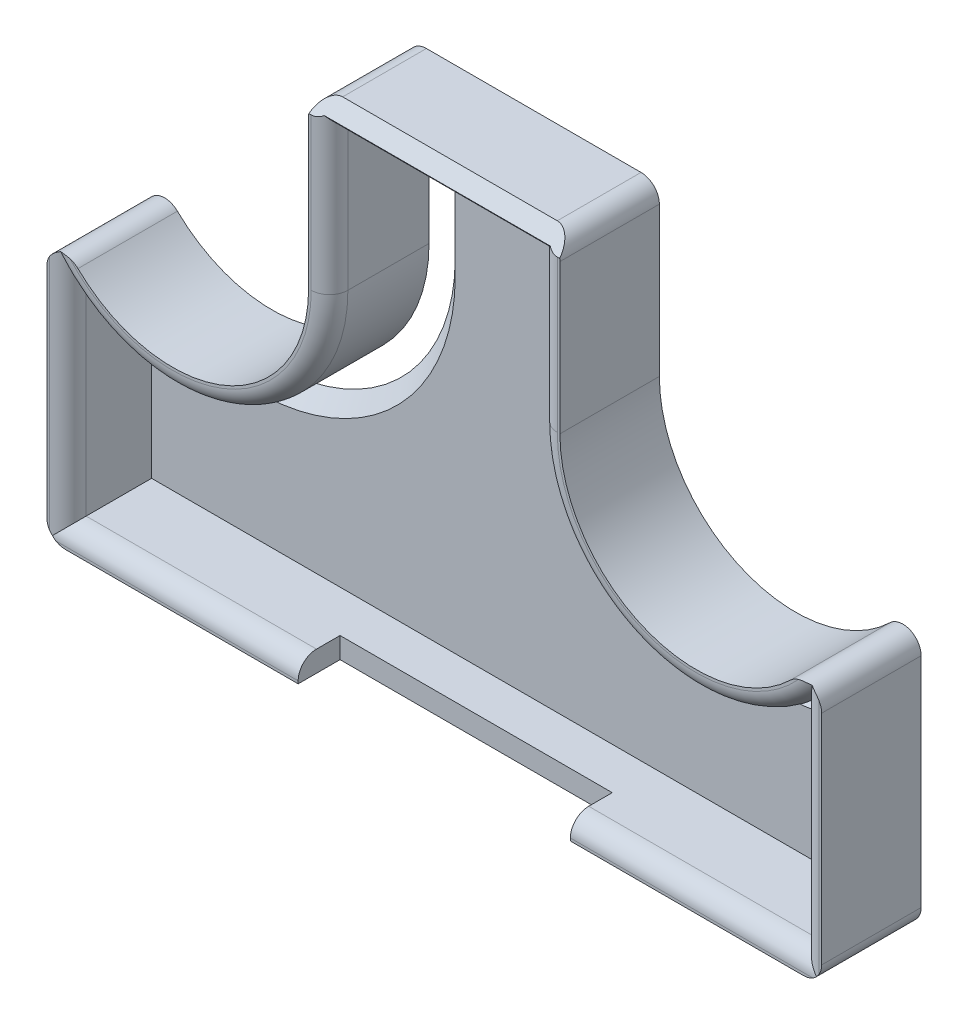
from build123d import *

# Parameters (mm, degrees)
BOSS_EXTRUDE1_DEPTH = 8
BOSS_EXTRUDE2_START = 1.5
BOSS_EXTRUDE2_DEPTH = 1.5
CHAMFER1_SIZE       = 1.5
CHAMFER2_SIZE       = 1.5
FILLET1_R           = 1.75
CUT_EXTRUDE1_REACH  = 89.56
SKETCH3_W           = 26
SKETCH3_H           = 4


# Some blends are built 0.0001 mm under size
with BuildPart() as part:
    # Sketch1 → Boss-Extrude1 (new body)
    with BuildSketch(Plane(origin=(0, 0, 0), x_dir=(-1, 0, 0), z_dir=(0, 0, 1))):
        with BuildLine():
            Line((2, 2), (-72, 2))
            Line((-72, 2), (-72, -26.180339887))
            ThreePointArc((-72, -26.180339887), (-57.450490243, -18.432791104), (-47, -31.180339887))
            Line((-47, -31.180339887), (-47, -47.180339887))
            Line((-47, -47.180339887), (-23, -47.180339887))
            Line((-23, -47.180339887), (-23, -31.180339887))
            ThreePointArc((-23, -31.180339887), (-12.549509757, -18.432791104), (2, -26.180339887))
            Line((2, -26.180339887), (2, 2))
        make_face()
        with BuildLine():
            Line((-70, 0), (0, 0))
            Line((0, 0), (0, -20))
            ThreePointArc((0, -20), (-16.123724357, -17.48727595), (-25, -31.180339887))
            Line((-25, -31.180339887), (-25, -45.180339887))
            Line((-25, -45.180339887), (-45, -45.180339887))
            Line((-45, -45.180339887), (-45, -31.180339887))
            ThreePointArc((-45, -31.180339887), (-53.876275643, -17.48727595), (-70, -20))
            Line((-70, -20), (-70, 0))
        make_face(mode=Mode.SUBTRACT)
    extrude(amount=BOSS_EXTRUDE1_DEPTH)

    # Sketch2 → Boss-Extrude2 (add)
    with BuildSketch(Plane(origin=(0, 0, 0), x_dir=(-1, 0, 0), z_dir=(0, 0, -1)).offset(BOSS_EXTRUDE2_START)):
        with BuildLine():
            Line((2, -2), (-72, -2))
            Line((-72, -2), (-72, 26.180339887))
            ThreePointArc((-72, 26.180339887), (-57.450490243, 18.432791104), (-47, 31.180339887))
            Line((-47, 31.180339887), (-47, 47.180339887))
            Line((-47, 47.180339887), (-23, 47.180339887))
            Line((-23, 47.180339887), (-23, 31.180339887))
            ThreePointArc((-23, 31.180339887), (-12.549509757, 18.432791104), (2, 26.180339887))
            Line((2, 26.180339887), (2, -2))
        make_face()
        with BuildLine():
            Line((-3, 17.913840726), (-3, 15.141324955))
            ThreePointArc((-3, 15.141324955), (-19.585144756, 16.538789423), (-27.5, 31.180339887))
            Line((-27.5, 31.180339887), (-27.5, 43.180339887))
            Line((-27.5, 43.180339887), (-25, 43.180339887))
            Line((-25, 43.180339887), (-25, 31.180339887))
            ThreePointArc((-25, 31.180339887), (-17.745966692, 18.335107309), (-3, 17.913840726))
        make_face(mode=Mode.SUBTRACT)
        with BuildLine():
            Line((-67, 17.913840726), (-67, 15.141324955))
            ThreePointArc((-67, 15.141324955), (-50.414855244, 16.538789423), (-42.5, 31.180339887))
            Line((-42.5, 31.180339887), (-42.5, 43.180339887))
            Line((-42.5, 43.180339887), (-45, 43.180339887))
            Line((-45, 43.180339887), (-45, 31.180339887))
            ThreePointArc((-45, 31.180339887), (-52.254033308, 18.335107309), (-67, 17.913840726))
        make_face(mode=Mode.SUBTRACT)
    extrude(amount=-BOSS_EXTRUDE2_DEPTH)

    # Chamfer1
    chamfer1_edges = [part.edges().sort_by_distance(p)[0] for p in [
        (42.5, 37.180339887, 0),
        (50.414855244, 16.538789423, 0),
        (27.5, 37.180339887, 0),
        (19.585144756, 16.538789423, 0),
    ]]
    chamfer(chamfer1_edges, length=CHAMFER1_SIZE - 0.0001)  # a hair under: the kernel refuses the full size

    # Chamfer2
    chamfer2_edges = [part.edges().sort_by_distance(p)[0] for p in [
        (35, 47.180339887, 8),
    ]]
    chamfer(chamfer2_edges, length=CHAMFER2_SIZE)

    # Fillet1
    # the kernel refuses this fillet: 1.75 mm, written as the material it takes off along each edge
    with BuildSketch(Plane(origin=(10, 31.180339887, 8), x_dir=(-0.8529681786661586, -0.5219629164825181, 0), z_dir=(-0.5219629164825181, 0.8529681786661586, 0))) as fillet1_piece_1_section:
        with BuildLine():
            CenterArc((15 - FILLET1_R, -FILLET1_R), FILLET1_R, 0, 90)
            Line((15, -FILLET1_R), (15 + FILLET1_R * 0.02, -FILLET1_R))
            Line((15 + FILLET1_R * 0.02, -FILLET1_R), (15 + FILLET1_R * 0.02, FILLET1_R * 0.02))
            Line((15 + FILLET1_R * 0.02, FILLET1_R * 0.02), (15 - FILLET1_R, FILLET1_R * 0.02))
            Line((15 - FILLET1_R, FILLET1_R * 0.02), (15 - FILLET1_R, 0))
        make_face()
    fillet1_piece_1 = revolve(axis=Axis((10, 31.180339887, 8), (0, 0, 1)), revolution_arc=148.535987608, mode=Mode.PRIVATE)
    fillet1_piece_1 = split(fillet1_piece_1, bisect_by=Plane(origin=(0, 17.590580618, 7.50852365), z_dir=(1, 0, 0)), keep=Keep.TOP, mode=Mode.PRIVATE)
    add(fillet1_piece_1, mode=Mode.SUBTRACT)
    with BuildSketch(Plane(origin=(0, 0, 8), x_dir=(-1, 0, 0), z_dir=(0, 1, 0))) as fillet1_piece_2_section:
        with BuildLine():
            CenterArc((FILLET1_R, -FILLET1_R), FILLET1_R, 90, 90)
            Line((0, -FILLET1_R), (-FILLET1_R * 0.02, -FILLET1_R))
            Line((-FILLET1_R * 0.02, -FILLET1_R), (-FILLET1_R * 0.02, FILLET1_R * 0.02))
            Line((-FILLET1_R * 0.02, FILLET1_R * 0.02), (FILLET1_R, FILLET1_R * 0.02))
            Line((FILLET1_R, FILLET1_R * 0.02), (FILLET1_R, 0))
        make_face()
    fillet1_piece_2 = extrude(amount=24.375, mode=Mode.PRIVATE)
    fillet1_piece_2 = fillet1_piece_2 - Plane(origin=(10, 31.180339887, 7.607877329), x_dir=(-0.6666666666666653, -0.7453559924999311, 0), z_dir=(0, 0, -1)) * Cylinder(15, 56, mode=Mode.PRIVATE)
    add(fillet1_piece_2, mode=Mode.SUBTRACT)
    with BuildSketch(Plane(origin=(25, 31.180339887, 8), x_dir=(-1, 0, 0), z_dir=(0, 1, 0)), Plane(origin=(45, 45.180339887, 8), x_dir=(1, 0, 0), z_dir=(0, -1, 0))) as fillet1_piece_3:
        with BuildLine():
            CenterArc((FILLET1_R, -FILLET1_R), FILLET1_R, 90, 90)
            Line((0, -FILLET1_R), (-FILLET1_R * 0.02, -FILLET1_R))
            Line((-FILLET1_R * 0.02, -FILLET1_R), (-FILLET1_R * 0.02, FILLET1_R * 0.02))
            Line((-FILLET1_R * 0.02, FILLET1_R * 0.02), (FILLET1_R, FILLET1_R * 0.02))
            Line((FILLET1_R, FILLET1_R * 0.02), (FILLET1_R, 0))
        make_face()
    extrude(amount=14, mode=Mode.SUBTRACT)
    with BuildSketch(Plane(origin=(70, 0, 8), x_dir=(0, -1, 0), z_dir=(-1, 0, 0))) as fillet1_piece_4:
        with BuildLine():
            CenterArc((FILLET1_R, -FILLET1_R), FILLET1_R, 90, 90)
            Line((0, -FILLET1_R), (-FILLET1_R * 0.02, -FILLET1_R))
            Line((-FILLET1_R * 0.02, -FILLET1_R), (-FILLET1_R * 0.02, FILLET1_R * 0.02))
            Line((-FILLET1_R * 0.02, FILLET1_R * 0.02), (FILLET1_R, FILLET1_R * 0.02))
            Line((FILLET1_R, FILLET1_R * 0.02), (FILLET1_R, 0))
        make_face()
    extrude(amount=70, mode=Mode.SUBTRACT)
    with BuildSketch(Plane(origin=(70, 24.375, 8), x_dir=(1, 0, 0), z_dir=(0, -1, 0))) as fillet1_piece_5_section:
        with BuildLine():
            CenterArc((FILLET1_R, -FILLET1_R), FILLET1_R, 90, 90)
            Line((0, -FILLET1_R), (-FILLET1_R * 0.02, -FILLET1_R))
            Line((-FILLET1_R * 0.02, -FILLET1_R), (-FILLET1_R * 0.02, FILLET1_R * 0.02))
            Line((-FILLET1_R * 0.02, FILLET1_R * 0.02), (FILLET1_R, FILLET1_R * 0.02))
            Line((FILLET1_R, FILLET1_R * 0.02), (FILLET1_R, 0))
        make_face()
    fillet1_piece_5 = extrude(amount=24.375, mode=Mode.PRIVATE)
    fillet1_piece_5 = fillet1_piece_5 - Plane(origin=(60, 31.180339887, 7.607877375), x_dir=(-1, 0, 0), z_dir=(0, 0, -1)) * Cylinder(15, 56, mode=Mode.PRIVATE)
    add(fillet1_piece_5, mode=Mode.SUBTRACT)
    with BuildSketch(Plane(origin=(60, 31.180339887, 8), x_dir=(-1, 0, 0), z_dir=(0, 1, 0))) as fillet1_piece_6_section:
        with BuildLine():
            CenterArc((15 - FILLET1_R, -FILLET1_R), FILLET1_R, 0, 90)
            Line((15, -FILLET1_R), (15 + FILLET1_R * 0.02, -FILLET1_R))
            Line((15 + FILLET1_R * 0.02, -FILLET1_R), (15 + FILLET1_R * 0.02, FILLET1_R * 0.02))
            Line((15 + FILLET1_R * 0.02, FILLET1_R * 0.02), (15 - FILLET1_R, FILLET1_R * 0.02))
            Line((15 - FILLET1_R, FILLET1_R * 0.02), (15 - FILLET1_R, 0))
        make_face()
    fillet1_piece_6 = revolve(axis=Axis((60, 31.180339887, 8), (0, 0, 1)), revolution_arc=148.535987608, mode=Mode.PRIVATE)
    fillet1_piece_6 = split(fillet1_piece_6, bisect_by=Plane(origin=(70, 17.590580683, 7.508523582), z_dir=(-1, 0, 0)), keep=Keep.TOP, mode=Mode.PRIVATE)
    add(fillet1_piece_6, mode=Mode.SUBTRACT)
    with BuildSketch(Plane(origin=(25, 45.180339887, 8), x_dir=(0, 1, 0), z_dir=(1, 0, 0))) as fillet1_piece_7:
        with BuildLine():
            CenterArc((FILLET1_R, -FILLET1_R), FILLET1_R, 90, 90)
            Line((0, -FILLET1_R), (-FILLET1_R * 0.02, -FILLET1_R))
            Line((-FILLET1_R * 0.02, -FILLET1_R), (-FILLET1_R * 0.02, FILLET1_R * 0.02))
            Line((-FILLET1_R * 0.02, FILLET1_R * 0.02), (FILLET1_R, FILLET1_R * 0.02))
            Line((FILLET1_R, FILLET1_R * 0.02), (FILLET1_R, 0))
        make_face()
    extrude(amount=20, mode=Mode.SUBTRACT)
    with BuildSketch(Plane(origin=(72, 26.180339887, -1.5), x_dir=(-0.5635217270596511, -0.8261012426644256, 0), z_dir=(0, 0, 1)), Plane(origin=(-2, 26.180339887, 8), x_dir=(0.5635217270596506, -0.8261012426644259, 0), z_dir=(0, 0, -1))) as fillet1_piece_8:
        with BuildLine():
            CenterArc((5.617783669, 1.713764708), FILLET1_R, 124.299700248, 134.020464453)
            Line((4.631620646, 3.159441883), (4.611897386, 3.188355426))
            Line((4.611897386, 3.188355426), (-0.01972326, 0.028913543))
            Line((-0.01972326, 0.028913543), (0.007085493, -0.034275294))
            ThreePointArc((0.007085493, -0.034275294), (2.631754511, 0.234176453), (5.25642353, -0.034275294))
            Line((5.25642353, -0.034275294), (5.263509023, 0))
        make_face()
    extrude(amount=9.5, mode=Mode.SUBTRACT)
    with BuildSketch(Plane(origin=(72, -2, -1.5), x_dir=(0, 1, 0), z_dir=(0, 0, 1)), Plane(origin=(-2, -2, -1.5), x_dir=(1, 0, 0), z_dir=(0, 0, 1))) as fillet1_piece_9:
        with BuildLine():
            CenterArc((FILLET1_R, FILLET1_R), FILLET1_R, 180, 90)
            Line((0, FILLET1_R), (-FILLET1_R * 0.02, FILLET1_R))
            Line((-FILLET1_R * 0.02, FILLET1_R), (-FILLET1_R * 0.02, -FILLET1_R * 0.02))
            Line((-FILLET1_R * 0.02, -FILLET1_R * 0.02), (FILLET1_R, -FILLET1_R * 0.02))
            Line((FILLET1_R, -FILLET1_R * 0.02), (FILLET1_R, 0))
        make_face()
    extrude(amount=9.5, mode=Mode.SUBTRACT)
    with BuildSketch(Plane(origin=(47, 47.180339887, -1.5), x_dir=(0, -1, 0), z_dir=(0, 0, 1))) as fillet1_piece_10_section:
        with BuildLine():
            CenterArc((FILLET1_R, -FILLET1_R), FILLET1_R, 90, 90)
            Line((0, -FILLET1_R), (-FILLET1_R * 0.02, -FILLET1_R))
            Line((-FILLET1_R * 0.02, -FILLET1_R), (-FILLET1_R * 0.02, FILLET1_R * 0.02))
            Line((-FILLET1_R * 0.02, FILLET1_R * 0.02), (FILLET1_R, FILLET1_R * 0.02))
            Line((FILLET1_R, FILLET1_R * 0.02), (FILLET1_R, 0))
        make_face()
    fillet1_piece_10 = extrude(amount=12.375, mode=Mode.PRIVATE)
    fillet1_piece_10 = split(fillet1_piece_10, bisect_by=Plane(origin=(46.61382335, 48.870482081, 4.809857807), z_dir=(0, -0.7071067811865476, -0.7071067811865476)), keep=Keep.TOP, mode=Mode.PRIVATE)
    add(fillet1_piece_10, mode=Mode.SUBTRACT)
    with BuildSketch(Plane(origin=(23, 47.180339887, 10.875), x_dir=(0, -1, 0), z_dir=(0, 0, -1))) as fillet1_piece_11_section:
        with BuildLine():
            CenterArc((FILLET1_R, -FILLET1_R), FILLET1_R, 90, 90)
            Line((0, -FILLET1_R), (-FILLET1_R * 0.02, -FILLET1_R))
            Line((-FILLET1_R * 0.02, -FILLET1_R), (-FILLET1_R * 0.02, FILLET1_R * 0.02))
            Line((-FILLET1_R * 0.02, FILLET1_R * 0.02), (FILLET1_R, FILLET1_R * 0.02))
            Line((FILLET1_R, FILLET1_R * 0.02), (FILLET1_R, 0))
        make_face()
    fillet1_piece_11 = extrude(amount=12.375, mode=Mode.PRIVATE)
    fillet1_piece_11 = split(fillet1_piece_11, bisect_by=Plane(origin=(23.38617665, 48.870482081, 4.809857807), z_dir=(0, -0.7071067811865476, -0.7071067811865476)), keep=Keep.TOP, mode=Mode.PRIVATE)
    add(fillet1_piece_11, mode=Mode.SUBTRACT)
    with BuildSketch(Plane(origin=(0, 0, 8), x_dir=(-1, 0, 0), z_dir=(0, 1, 0))) as fillet1_piece_12a_section:
        with BuildLine():
            CenterArc((FILLET1_R, -FILLET1_R), FILLET1_R, 90, 90)
            Line((0, -FILLET1_R), (-FILLET1_R * 0.02, -FILLET1_R))
            Line((-FILLET1_R * 0.02, -FILLET1_R), (-FILLET1_R * 0.02, FILLET1_R * 0.02))
            Line((-FILLET1_R * 0.02, FILLET1_R * 0.02), (FILLET1_R, FILLET1_R * 0.02))
            Line((FILLET1_R, FILLET1_R * 0.02), (FILLET1_R, 0))
        make_face()
    fillet1_piece_12a = extrude(amount=24.375, mode=Mode.PRIVATE)
    fillet1_piece_12a = fillet1_piece_12a & Plane(origin=(10, 31.180339887, 7.583047858), x_dir=(-0.6666666666666653, -0.7453559924999311, 0), z_dir=(0, 0, -1)) * Cylinder(15, 56, mode=Mode.PRIVATE)
    with BuildSketch(Plane(origin=(10, 31.180339887, 8), x_dir=(-0.8529681786661586, -0.5219629164825181, 0), z_dir=(-0.5219629164825181, 0.8529681786661586, 0))) as fillet1_piece_12b_section:
        with BuildLine():
            CenterArc((15 - FILLET1_R, -FILLET1_R), FILLET1_R, 0, 90)
            Line((15, -FILLET1_R), (15 + FILLET1_R * 0.02, -FILLET1_R))
            Line((15 + FILLET1_R * 0.02, -FILLET1_R), (15 + FILLET1_R * 0.02, FILLET1_R * 0.02))
            Line((15 + FILLET1_R * 0.02, FILLET1_R * 0.02), (15 - FILLET1_R, FILLET1_R * 0.02))
            Line((15 - FILLET1_R, FILLET1_R * 0.02), (15 - FILLET1_R, 0))
        make_face()
    fillet1_piece_12b = revolve(axis=Axis((10, 31.180339887, 8), (0, 0, 1)), revolution_arc=148.535987608, mode=Mode.PRIVATE)
    fillet1_piece_12b = split(fillet1_piece_12b, bisect_by=Plane(origin=(0, 21.951360375, 7.57760015), z_dir=(-1, 0, 0)), keep=Keep.TOP, mode=Mode.PRIVATE)
    fillet1_piece_12 = fillet1_piece_12a & fillet1_piece_12b
    add(fillet1_piece_12, mode=Mode.SUBTRACT)
    with BuildSketch(Plane(origin=(70, 0, 8), x_dir=(0, -1, 0), z_dir=(-1, 0, 0))) as fillet1_piece_13a_section:
        with BuildLine():
            CenterArc((FILLET1_R, -FILLET1_R), FILLET1_R, 90, 90)
            Line((0, -FILLET1_R), (-FILLET1_R * 0.02, -FILLET1_R))
            Line((-FILLET1_R * 0.02, -FILLET1_R), (-FILLET1_R * 0.02, FILLET1_R * 0.02))
            Line((-FILLET1_R * 0.02, FILLET1_R * 0.02), (FILLET1_R, FILLET1_R * 0.02))
            Line((FILLET1_R, FILLET1_R * 0.02), (FILLET1_R, 0))
        make_face()
    fillet1_piece_13a = extrude(amount=74.375, mode=Mode.PRIVATE)
    fillet1_piece_13a = split(fillet1_piece_13a, bisect_by=Plane(origin=(0, -0.39619145, 7.60380855), z_dir=(-1, 0, 0)), keep=Keep.TOP, mode=Mode.PRIVATE)
    with BuildSketch(Plane(origin=(0, -4.375, 8), x_dir=(-1, 0, 0), z_dir=(0, 1, 0))) as fillet1_piece_13b_section:
        with BuildLine():
            CenterArc((FILLET1_R, -FILLET1_R), FILLET1_R, 90, 90)
            Line((0, -FILLET1_R), (-FILLET1_R * 0.02, -FILLET1_R))
            Line((-FILLET1_R * 0.02, -FILLET1_R), (-FILLET1_R * 0.02, FILLET1_R * 0.02))
            Line((-FILLET1_R * 0.02, FILLET1_R * 0.02), (FILLET1_R, FILLET1_R * 0.02))
            Line((FILLET1_R, FILLET1_R * 0.02), (FILLET1_R, 0))
        make_face()
    fillet1_piece_13b = extrude(amount=28.75, mode=Mode.PRIVATE)
    fillet1_piece_13b = split(fillet1_piece_13b, bisect_by=Plane(origin=(-0.39619145, 0, 7.60380855), z_dir=(0, -1, 0)), keep=Keep.TOP, mode=Mode.PRIVATE)
    fillet1_piece_13 = fillet1_piece_13a & fillet1_piece_13b
    add(fillet1_piece_13, mode=Mode.SUBTRACT)
    with BuildSketch(Plane(origin=(25, 31.180339887, 8), x_dir=(-1, 0, 0), z_dir=(0, 1, 0))) as fillet1_piece_14a_section:
        with BuildLine():
            CenterArc((FILLET1_R, -FILLET1_R), FILLET1_R, 90, 90)
            Line((0, -FILLET1_R), (-FILLET1_R * 0.02, -FILLET1_R))
            Line((-FILLET1_R * 0.02, -FILLET1_R), (-FILLET1_R * 0.02, FILLET1_R * 0.02))
            Line((-FILLET1_R * 0.02, FILLET1_R * 0.02), (FILLET1_R, FILLET1_R * 0.02))
            Line((FILLET1_R, FILLET1_R * 0.02), (FILLET1_R, 0))
        make_face()
    fillet1_piece_14a = extrude(amount=18.375, mode=Mode.PRIVATE)
    fillet1_piece_14a = split(fillet1_piece_14a, bisect_by=Plane(origin=(24.60380855, 45.180339887, 7.60380855), z_dir=(0, 1, 0)), keep=Keep.TOP, mode=Mode.PRIVATE)
    with BuildSketch(Plane(origin=(20.625, 45.180339887, 8), x_dir=(0, 1, 0), z_dir=(1, 0, 0))) as fillet1_piece_14b_section:
        with BuildLine():
            CenterArc((FILLET1_R, -FILLET1_R), FILLET1_R, 90, 90)
            Line((0, -FILLET1_R), (-FILLET1_R * 0.02, -FILLET1_R))
            Line((-FILLET1_R * 0.02, -FILLET1_R), (-FILLET1_R * 0.02, FILLET1_R * 0.02))
            Line((-FILLET1_R * 0.02, FILLET1_R * 0.02), (FILLET1_R, FILLET1_R * 0.02))
            Line((FILLET1_R, FILLET1_R * 0.02), (FILLET1_R, 0))
        make_face()
    fillet1_piece_14b = extrude(amount=24.375, mode=Mode.PRIVATE)
    fillet1_piece_14b = split(fillet1_piece_14b, bisect_by=Plane(origin=(25, 45.576531337, 7.60380855), z_dir=(-1, 0, 0)), keep=Keep.TOP, mode=Mode.PRIVATE)
    fillet1_piece_14 = fillet1_piece_14a & fillet1_piece_14b
    add(fillet1_piece_14, mode=Mode.SUBTRACT)
    with BuildSketch(Plane(origin=(70, 24.375, 8), x_dir=(1, 0, 0), z_dir=(0, -1, 0))) as fillet1_piece_15a_section:
        with BuildLine():
            CenterArc((FILLET1_R, -FILLET1_R), FILLET1_R, 90, 90)
            Line((0, -FILLET1_R), (-FILLET1_R * 0.02, -FILLET1_R))
            Line((-FILLET1_R * 0.02, -FILLET1_R), (-FILLET1_R * 0.02, FILLET1_R * 0.02))
            Line((-FILLET1_R * 0.02, FILLET1_R * 0.02), (FILLET1_R, FILLET1_R * 0.02))
            Line((FILLET1_R, FILLET1_R * 0.02), (FILLET1_R, 0))
        make_face()
    fillet1_piece_15a = extrude(amount=28.75, mode=Mode.PRIVATE)
    fillet1_piece_15a = split(fillet1_piece_15a, bisect_by=Plane(origin=(70.39619145, 0, 7.60380855), z_dir=(0, -1, 0)), keep=Keep.TOP, mode=Mode.PRIVATE)
    with BuildSketch(Plane(origin=(74.375, 0, 8), x_dir=(0, -1, 0), z_dir=(-1, 0, 0))) as fillet1_piece_15b_section:
        with BuildLine():
            CenterArc((FILLET1_R, -FILLET1_R), FILLET1_R, 90, 90)
            Line((0, -FILLET1_R), (-FILLET1_R * 0.02, -FILLET1_R))
            Line((-FILLET1_R * 0.02, -FILLET1_R), (-FILLET1_R * 0.02, FILLET1_R * 0.02))
            Line((-FILLET1_R * 0.02, FILLET1_R * 0.02), (FILLET1_R, FILLET1_R * 0.02))
            Line((FILLET1_R, FILLET1_R * 0.02), (FILLET1_R, 0))
        make_face()
    fillet1_piece_15b = extrude(amount=74.375, mode=Mode.PRIVATE)
    fillet1_piece_15b = split(fillet1_piece_15b, bisect_by=Plane(origin=(70, -0.39619145, 7.60380855), z_dir=(1, 0, 0)), keep=Keep.TOP, mode=Mode.PRIVATE)
    fillet1_piece_15 = fillet1_piece_15a & fillet1_piece_15b
    add(fillet1_piece_15, mode=Mode.SUBTRACT)
    with BuildSketch(Plane(origin=(70, 24.375, 8), x_dir=(1, 0, 0), z_dir=(0, -1, 0))) as fillet1_piece_16a_section:
        with BuildLine():
            CenterArc((FILLET1_R, -FILLET1_R), FILLET1_R, 90, 90)
            Line((0, -FILLET1_R), (-FILLET1_R * 0.02, -FILLET1_R))
            Line((-FILLET1_R * 0.02, -FILLET1_R), (-FILLET1_R * 0.02, FILLET1_R * 0.02))
            Line((-FILLET1_R * 0.02, FILLET1_R * 0.02), (FILLET1_R, FILLET1_R * 0.02))
            Line((FILLET1_R, FILLET1_R * 0.02), (FILLET1_R, 0))
        make_face()
    fillet1_piece_16a = extrude(amount=24.375, mode=Mode.PRIVATE)
    fillet1_piece_16a = fillet1_piece_16a & Plane(origin=(60, 31.180339887, 7.583047884), x_dir=(-1, 0, 0), z_dir=(0, 0, -1)) * Cylinder(15, 56, mode=Mode.PRIVATE)
    with BuildSketch(Plane(origin=(60, 31.180339887, 8), x_dir=(-1, 0, 0), z_dir=(0, 1, 0))) as fillet1_piece_16b_section:
        with BuildLine():
            CenterArc((15 - FILLET1_R, -FILLET1_R), FILLET1_R, 0, 90)
            Line((15, -FILLET1_R), (15 + FILLET1_R * 0.02, -FILLET1_R))
            Line((15 + FILLET1_R * 0.02, -FILLET1_R), (15 + FILLET1_R * 0.02, FILLET1_R * 0.02))
            Line((15 + FILLET1_R * 0.02, FILLET1_R * 0.02), (15 - FILLET1_R, FILLET1_R * 0.02))
            Line((15 - FILLET1_R, FILLET1_R * 0.02), (15 - FILLET1_R, 0))
        make_face()
    fillet1_piece_16b = revolve(axis=Axis((60, 31.180339887, 8), (0, 0, 1)), revolution_arc=148.535987608, mode=Mode.PRIVATE)
    fillet1_piece_16b = split(fillet1_piece_16b, bisect_by=Plane(origin=(70, 21.951360527, 7.577600104), z_dir=(1, 0, 0)), keep=Keep.TOP, mode=Mode.PRIVATE)
    fillet1_piece_16 = fillet1_piece_16a & fillet1_piece_16b
    add(fillet1_piece_16, mode=Mode.SUBTRACT)
    with BuildSketch(Plane(origin=(25, 45.180339887, 8), x_dir=(0, 1, 0), z_dir=(1, 0, 0))) as fillet1_piece_17a_section:
        with BuildLine():
            CenterArc((FILLET1_R, -FILLET1_R), FILLET1_R, 90, 90)
            Line((0, -FILLET1_R), (-FILLET1_R * 0.02, -FILLET1_R))
            Line((-FILLET1_R * 0.02, -FILLET1_R), (-FILLET1_R * 0.02, FILLET1_R * 0.02))
            Line((-FILLET1_R * 0.02, FILLET1_R * 0.02), (FILLET1_R, FILLET1_R * 0.02))
            Line((FILLET1_R, FILLET1_R * 0.02), (FILLET1_R, 0))
        make_face()
    fillet1_piece_17a = extrude(amount=24.375, mode=Mode.PRIVATE)
    fillet1_piece_17a = split(fillet1_piece_17a, bisect_by=Plane(origin=(45, 45.576531337, 7.60380855), z_dir=(1, 0, 0)), keep=Keep.TOP, mode=Mode.PRIVATE)
    with BuildSketch(Plane(origin=(45, 49.555339887, 8), x_dir=(1, 0, 0), z_dir=(0, -1, 0))) as fillet1_piece_17b_section:
        with BuildLine():
            CenterArc((FILLET1_R, -FILLET1_R), FILLET1_R, 90, 90)
            Line((0, -FILLET1_R), (-FILLET1_R * 0.02, -FILLET1_R))
            Line((-FILLET1_R * 0.02, -FILLET1_R), (-FILLET1_R * 0.02, FILLET1_R * 0.02))
            Line((-FILLET1_R * 0.02, FILLET1_R * 0.02), (FILLET1_R, FILLET1_R * 0.02))
            Line((FILLET1_R, FILLET1_R * 0.02), (FILLET1_R, 0))
        make_face()
    fillet1_piece_17b = extrude(amount=18.375, mode=Mode.PRIVATE)
    fillet1_piece_17b = split(fillet1_piece_17b, bisect_by=Plane(origin=(45.39619145, 45.180339887, 7.60380855), z_dir=(0, 1, 0)), keep=Keep.TOP, mode=Mode.PRIVATE)
    fillet1_piece_17 = fillet1_piece_17a & fillet1_piece_17b
    add(fillet1_piece_17, mode=Mode.SUBTRACT)

    # Sketch3 → Cut-Extrude1 (cut, up to next)
    with BuildSketch(Plane.XZ.offset(2), mode=Mode.PRIVATE) as cut_extrude1_sk1:
        with Locations((35, 6)):
            Rectangle(SKETCH3_W, SKETCH3_H)
    cut_extrude1_tool1 = extrude(cut_extrude1_sk1.sketch, amount=-CUT_EXTRUDE1_REACH, mode=Mode.PRIVATE) & part.part
    add(cut_extrude1_tool1.solids().sort_by_distance((35, -2, 6))[0], mode=Mode.SUBTRACT)


solid = part.part
